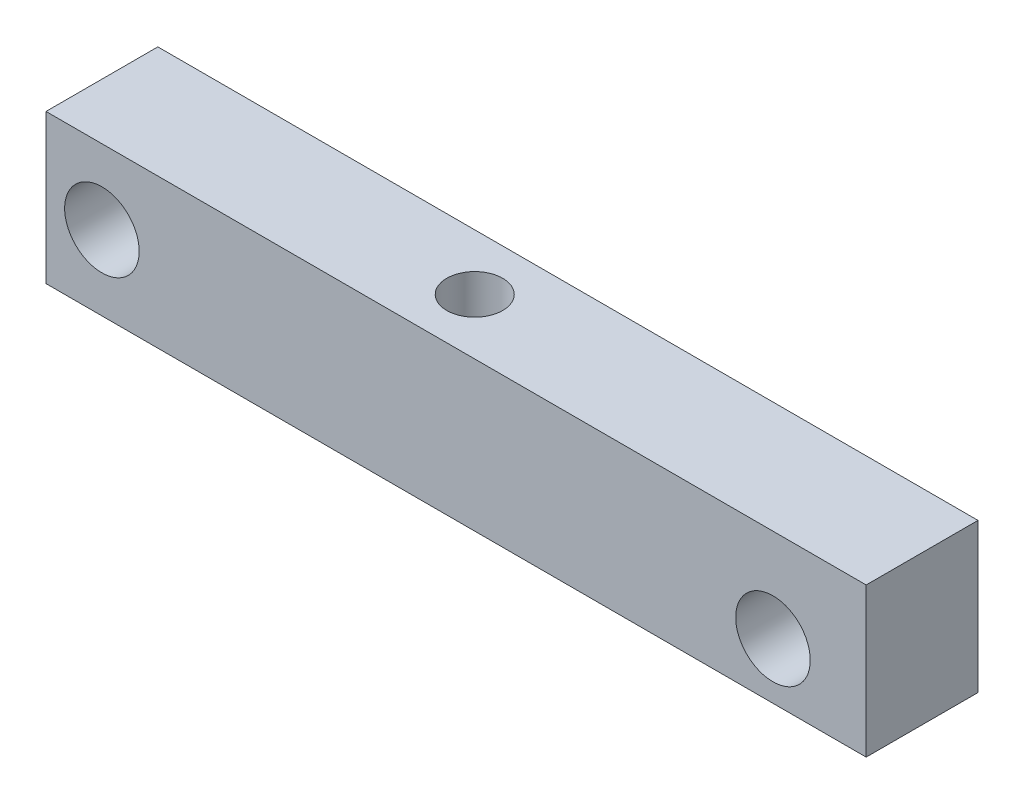
from build123d import *

# Parameters (mm, degrees)
CROQUIS1_W              = 22
CROQUIS1_H              = 4
SALIENTE_EXTRUIR1_DEPTH = 3
CROQUIS2_R              = 0.75
CORTAR_EXTRUIR1_DEPTH   = 3
CORTAR_EXTRUIR2_REACH   = 13.576
CROQUIS3_R              = 1


with BuildPart() as part:
    # Croquis1 → Saliente-Extruir1 (new body)
    with BuildSketch(Plane.XY):
        Rectangle(CROQUIS1_W, CROQUIS1_H)
    extrude(amount=SALIENTE_EXTRUIR1_DEPTH)

    # Croquis2 → Cortar-Extruir1 (cut)
    with BuildSketch(Plane(origin=(0, 2, 0), x_dir=(1, 0, 0), z_dir=(0, 1, 0))):
        with Locations((-1, -1.5)):
            Circle(CROQUIS2_R)
    extrude(amount=-CORTAR_EXTRUIR1_DEPTH, mode=Mode.SUBTRACT)

    # Croquis3 → Cortar-Extruir2 (cut, up to next)
    with BuildSketch(Plane.XY.offset(3), mode=Mode.PRIVATE) as cortar_extruir2_sk1:
        with Locations((8.5, -0.5)):
            Circle(CROQUIS3_R)
    cortar_extruir2_tool1 = extrude(cortar_extruir2_sk1.sketch, amount=-CORTAR_EXTRUIR2_REACH, mode=Mode.PRIVATE) & part.part
    # Croquis3 → Cortar-Extruir2 (cut, up to next)
    with BuildSketch(Plane.XY.offset(3), mode=Mode.PRIVATE) as cortar_extruir2_sk2:
        with Locations((-9.5, 0)):
            Circle(CROQUIS3_R)
    cortar_extruir2_tool2 = extrude(cortar_extruir2_sk2.sketch, amount=-CORTAR_EXTRUIR2_REACH, mode=Mode.PRIVATE) & part.part
    add(cortar_extruir2_tool1.solids().sort_by_distance((8.5, -0.5, 3))[0], mode=Mode.SUBTRACT)
    add(cortar_extruir2_tool2.solids().sort_by_distance((-9.5, 0, 3))[0], mode=Mode.SUBTRACT)


solid = part.part
